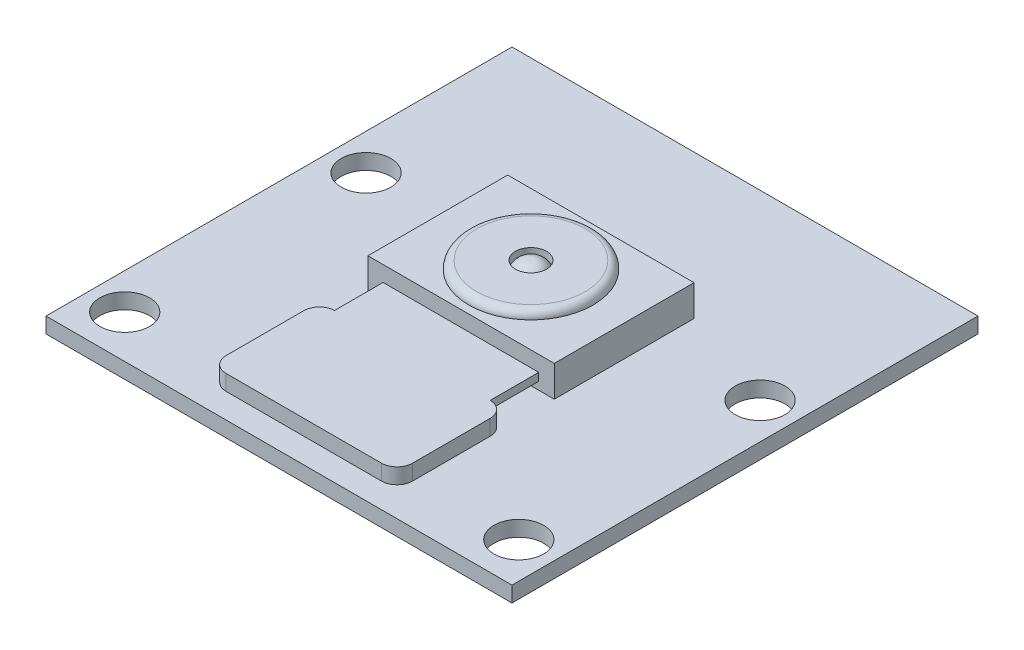
from build123d import *

# Parameters (mm, degrees)
CROQUIS1_W              = 30
CROQUIS1_H              = 30
CROQUIS1_R              = 1.6
SALIENTE_EXTRUIR1_DEPTH = 1
SALIENTE_EXTRUIR2_DEPTH = 1
CROQUIS3_W              = 12
CROQUIS3_H              = 9
SALIENTE_EXTRUIR3_DEPTH = 2
CROQUIS4_W              = 10.022371477
CROQUIS4_H              = 0.5
SALIENTE_EXTRUIR4_DEPTH = 4
CROQUIS6_R              = 4
SALIENTE_EXTRUIR5_DEPTH = 0.5
REDONDEO1_R             = 0.5
CROQUIS7_R              = 1
CORTAR_EXTRUIR1_DEPTH   = 0.5


with BuildPart() as part:
    # Croquis1 → Saliente-Extruir1 (new body)
    with BuildSketch(Plane(origin=(0, 0, 0), x_dir=(1, 0, 0), z_dir=(0, 1, 0))):
        Rectangle(CROQUIS1_W, CROQUIS1_H)
        with Locations(Location((-12.684412522, 3.286142093, 0), (0, 0, 270))):
            Circle(CROQUIS1_R, mode=Mode.SUBTRACT)
        with Locations(Location((-12.684412522, -12.247114296, 0), (0, 0, 270))):
            Circle(CROQUIS1_R, mode=Mode.SUBTRACT)
        with Locations(Location((12.684412522, -12.247114296, 0), (0, 0, 90))):
            Circle(CROQUIS1_R, mode=Mode.SUBTRACT)
        with Locations(Location((12.684412522, 3.286142093, 0), (0, 0, 90))):
            Circle(CROQUIS1_R, mode=Mode.SUBTRACT)
    extrude(amount=SALIENTE_EXTRUIR1_DEPTH)

    # Croquis2 → Saliente-Extruir2 (add)
    with BuildSketch(Plane(origin=(0, 1, 0), x_dir=(1, 0, 0), z_dir=(0, 1, 0))):
        with BuildLine():
            Line((-5, -13.403521049), (5, -13.403521049))
            ThreePointArc((5, -13.403521049), (5.707106781, -13.110627831), (6, -12.403521049))
            Line((6, -12.403521049), (6, -7.403521049))
            ThreePointArc((6, -7.403521049), (5.707106781, -6.696414268), (5, -6.403521049))
            Line((5, -6.403521049), (-5, -6.403521049))
            ThreePointArc((-5, -6.403521049), (-5.707106781, -6.696414268), (-6, -7.403521049))
            Line((-6, -7.403521049), (-6, -12.403521049))
            ThreePointArc((-6, -12.403521049), (-5.707106781, -13.110627831), (-5, -13.403521049))
        make_face()
    extrude(amount=SALIENTE_EXTRUIR2_DEPTH)

    # Croquis3 → Saliente-Extruir3 (add)
    with BuildSketch(Plane(origin=(0, 1, 0), x_dir=(1, 0, 0), z_dir=(0, 1, 0))):
        with Locations((0, 1.221480481)):
            Rectangle(CROQUIS3_W, CROQUIS3_H)
    extrude(amount=SALIENTE_EXTRUIR3_DEPTH)

    # Croquis4 → Saliente-Extruir4 (add)
    with BuildSketch(Plane(origin=(0, 0, 6.403521049), x_dir=(-1, 0, 0), z_dir=(0, 0, -1))):
        with Locations((0.011185739, 1.75)):
            Rectangle(CROQUIS4_W, CROQUIS4_H)
    extrude(amount=SALIENTE_EXTRUIR4_DEPTH)

    # Croquis6 → Saliente-Extruir5 (add)
    with BuildSketch(Plane(origin=(0, 3, 0), x_dir=(1, 0, 0), z_dir=(0, 1, 0))):
        with Locations(Location((0, 1.221480481, 0), (0, 0, 90))):
            Circle(CROQUIS6_R)
    extrude(amount=SALIENTE_EXTRUIR5_DEPTH)

    # Redondeo1
    redondeo1_edges = [part.edges().sort_by_distance(p)[0] for p in [
        (0, 3.5, 2.778519519),
    ]]
    fillet(redondeo1_edges, radius=REDONDEO1_R - 0.0001)  # a hair under: the kernel refuses the full size

    # Croquis7 → Cortar-Extruir1 (cut)
    with BuildSketch(Plane(origin=(0, 3.5, 0), x_dir=(1, 0, 0), z_dir=(0, 1, 0))):
        with Locations(Location((0, 1.221480481, 0), (0, 0, 270))):
            Circle(CROQUIS7_R)
    extrude(amount=-CORTAR_EXTRUIR1_DEPTH, mode=Mode.SUBTRACT)

    # Croquis9 → Revolución1 (revolve)
    with BuildSketch(Plane(origin=(0, 0, 0), x_dir=(0, 0, -1), z_dir=(1, 0, 0))):
        with BuildLine():
            Line((0.219475517, 2.997223498), (1.217042009, 2.997223498))
            Line((1.217042009, 2.997223498), (1.217042009, 3.546288473))
            ThreePointArc((1.217042009, 3.546288473), (0.626672887, 3.438153416), (0.219475517, 2.997223498))
        make_face()
    revolve(axis=Axis((0, 2.997223498, -1.217042009), (0, 1, 0)))


solid = part.part
